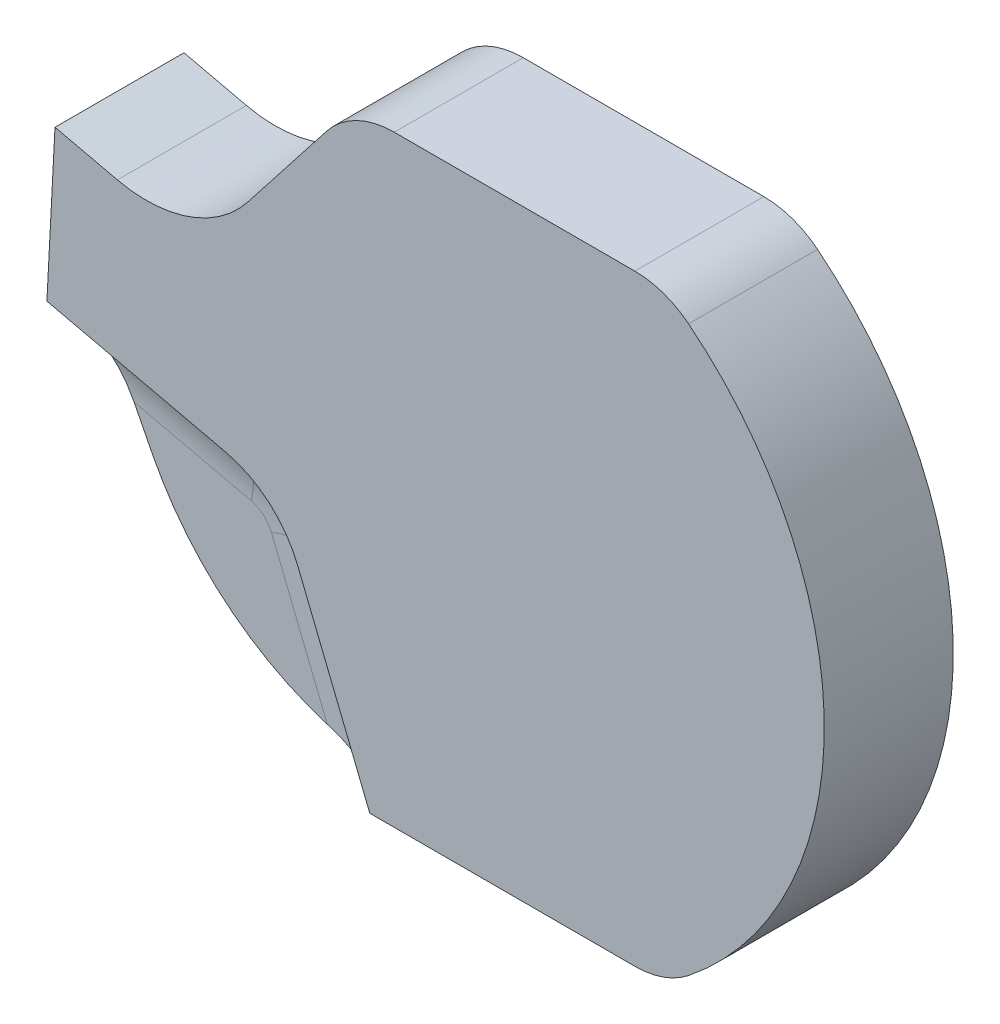
from build123d import *

# Parameters (mm, degrees)
BOSS_EXTRUDE1_DEPTH   = 15
CORTE_EXTRUS_O1_DEPTH = 5
CORTE_EXTRUS_O2_START = -10
CORTE_EXTRUS_O2_DEPTH = 5
FILETE1_R             = 10


with BuildPart() as part:
    # Sketch2 → Boss-Extrude1 (new body)
    with BuildSketch(Plane.XY):
        with BuildLine():
            Line((-40.19459236, 14.102844367), (-47.445652556, 15.776883518))
            Line((-47.445652556, 15.776883518), (-48.388260059, -2.209139093))
            Line((-48.388260059, -2.209139093), (-41.139476942, -16.435676991))
            ThreePointArc((-41.139476942, -16.435676991), (-28.61020632, -29.989765588), (-10.845255119, -35))
            Line((-10.845255119, -35), (-8, -35))
            Line((-8, -35), (19.974984355, -35))
            ThreePointArc((19.974984355, -35), (23.282173494, -34.437293044), (26.217166967, -32.8125))
            ThreePointArc((26.217166967, -32.8125), (42, 0), (26.217166967, 32.8125))
            ThreePointArc((26.217166967, 32.8125), (23.282173494, 34.437293044), (19.974984355, 35))
            Line((19.974984355, 35), (-8, 35))
            ThreePointArc((-8, 35), (-12.383711468, 33.987940463), (-15.880107536, 31.156614753))
            Line((-15.880107536, 31.156614753), (-25.000165241, 19.483473209))
            ThreePointArc((-25.000165241, 19.483473209), (-31.813223657, 14.578772972), (-40.19459236, 14.102844367))
        make_face()
    extrude(amount=BOSS_EXTRUDE1_DEPTH)

    # Esboço4 → Corte-extrusão1 (cut)
    with BuildSketch(Plane(origin=(0, 0, 0), x_dir=(-1, 0, 0), z_dir=(0, 0, -1))):
        with BuildLine():
            Line((48.388260059, -2.209139093), (27.681074333, -6.989769605))
            ThreePointArc((27.681074333, -6.989769605), (22.587110405, -9.557338795), (19.25428073, -14.186931261))
            Line((19.25428073, -14.186931261), (10.845255119, -35))
            ThreePointArc((10.845255119, -35), (28.61020632, -29.989765588), (41.139476942, -16.435676991))
            Line((41.139476942, -16.435676991), (48.388260059, -2.209139093))
        make_face()
    extrude(amount=-CORTE_EXTRUS_O1_DEPTH, mode=Mode.SUBTRACT)

    # Esboço4<2> → Corte-extrusão2 (cut)
    with BuildSketch(Plane(origin=(0, 0, 0), x_dir=(-1, 0, 0), z_dir=(0, 0, -1)).offset(CORTE_EXTRUS_O2_START)):
        with BuildLine():
            Line((48.388260059, -2.209139093), (27.681074333, -6.989769605))
            ThreePointArc((27.681074333, -6.989769605), (22.587110405, -9.557338795), (19.25428073, -14.186931261))
            Line((19.25428073, -14.186931261), (10.845255119, -35))
            ThreePointArc((10.845255119, -35), (28.61020632, -29.989765588), (41.139476942, -16.435676991))
            Line((41.139476942, -16.435676991), (48.388260059, -2.209139093))
        make_face()
    extrude(amount=-CORTE_EXTRUS_O2_DEPTH, mode=Mode.SUBTRACT)

    # Filete1
    # the kernel refuses this fillet: 10 mm, written as the material it adds along each edge
    with BuildSketch(Plane(origin=(-19.25428073, -14.186931261, 10), x_dir=(0, 0, 1), z_dir=(0.3746065934159196, -0.9271838545667843, 0))) as filete1_piece_1_section:
        with BuildLine():
            CenterArc((10, 8.660254038), FILETE1_R, 180, 60)
            Line((0, 8.660254038), (0, 0))
            Line((0, 0), (5, 0))
        make_face()
    filete1_piece_1 = extrude(amount=44.098252831, mode=Mode.PRIVATE)
    filete1_piece_1 = filete1_piece_1 & Plane(origin=(-10.845255119, -1, 11.322425454), x_dir=(-0.891006524188372, -0.4539904997395388, 0), z_dir=(0, 0, -1)) * Cylinder(34, 123, mode=Mode.PRIVATE)
    add(filete1_piece_1)
    with BuildSketch(Plane(origin=(-69.483990779, 2.661194099, 10), x_dir=(0, 0, 1), z_dir=(0.9743700647852346, -0.2249510543438682, 0))) as filete1_piece_2_section:
        with BuildLine():
            CenterArc((10, 8.660254038), FILETE1_R, 180, 60)
            Line((0, 8.660254038), (0, 0))
            Line((0, 0), (5, 0))
        make_face()
    filete1_piece_2 = extrude(amount=42.902504867, mode=Mode.PRIVATE)
    filete1_piece_2 = split(filete1_piece_2, bisect_by=Plane(origin=(-44.017931787, -10.786391272, 11.322425454), z_dir=(0.8910065241883723, 0.4539904997395381, 0)), keep=Keep.TOP, mode=Mode.PRIVATE)
    add(filete1_piece_2)
    with BuildSketch(Plane(origin=(-69.483990779, 2.661194099, 5), x_dir=(0, 0, -1), z_dir=(0.9743700647852346, -0.2249510543438682, 0))) as filete1_piece_3_section:
        with BuildLine():
            CenterArc((10, -8.660254038), FILETE1_R, 120, 60)
            Line((0, -8.660254038), (0, 0))
            Line((0, 0), (5, 0))
        make_face()
    filete1_piece_3 = extrude(amount=42.902504867, mode=Mode.PRIVATE)
    filete1_piece_3 = split(filete1_piece_3, bisect_by=Plane(origin=(-44.017931791, -10.786391265, 3.677574546), z_dir=(0.8910065241883723, 0.4539904997395381, 0)), keep=Keep.TOP, mode=Mode.PRIVATE)
    add(filete1_piece_3)
    with BuildSketch(Plane(origin=(-19.25428073, -14.186931261, 5), x_dir=(0, 0, -1), z_dir=(0.3746065934159196, -0.9271838545667843, 0))) as filete1_piece_4_section:
        with BuildLine():
            CenterArc((10, -8.660254038), FILETE1_R, 120, 60)
            Line((0, -8.660254038), (0, 0))
            Line((0, 0), (5, 0))
        make_face()
    filete1_piece_4 = extrude(amount=44.098252831, mode=Mode.PRIVATE)
    filete1_piece_4 = filete1_piece_4 & Plane(origin=(-10.845255119, -1, 3.677574546), x_dir=(-0.891006524188372, -0.4539904997395388, 0), z_dir=(0, 0, -1)) * Cylinder(34, 123, mode=Mode.PRIVATE)
    add(filete1_piece_4)
    with BuildSketch(Plane(origin=(-30.380486985, -18.682210382, 10), x_dir=(0.22495105434386828, 0.9743700647852345, 0), z_dir=(-0.9743700647852345, 0.22495105434386828, 0))) as filete1_piece_5:
        with BuildLine():
            CenterArc((3.339745962, -10), FILETE1_R, 30, 60)
            Line((3.339745962, 0), (12, 0))
            Line((12, 0), (12, -5))
        make_face()
    revolve(axis=Axis((-30.380486985, -18.682210382, 10), (0, 0, -1)), revolution_arc=55)
    with BuildSketch(Plane(origin=(-30.380486985, -18.682210382, 5), x_dir=(0.22495105434386828, 0.9743700647852345, 0), z_dir=(-0.9743700647852345, 0.22495105434386828, 0))) as filete1_piece_6:
        with BuildLine():
            CenterArc((3.339745962, 10), FILETE1_R, 270, 60)
            Line((3.339745962, 0), (12, 0))
            Line((12, 0), (12, 5))
        make_face()
    revolve(axis=Axis((-30.380486985, -18.682210382, 5), (0, 0, -1)), revolution_arc=55)


solid = part.part
